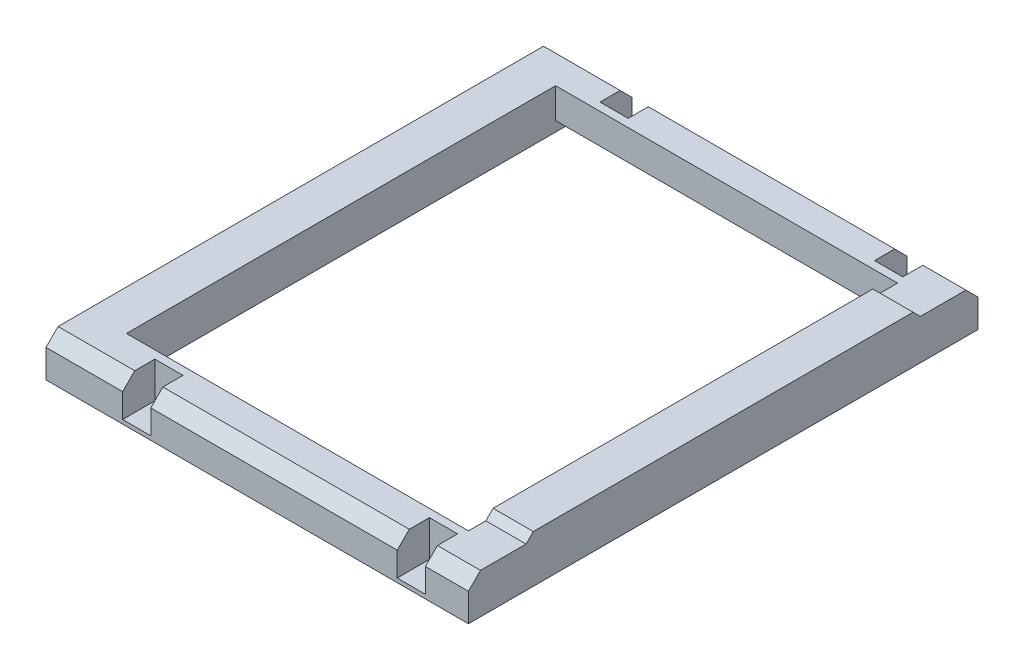
from build123d import *

# Parameters (mm, degrees)
SKETCH2_W           = 133.35
SKETCH2_H           = 160.866666666
SKETCH2_W_2         = 107.95
SKETCH2_H_2         = 135.466666666
BOSS_EXTRUDE1_DEPTH = 12.7
CUT_EXTRUDE1_DEPTH  = 6.35
CHAMFER1_SIZE       = 0.635
CHAMFER3_SIZE       = 3.81
SKETCH5_W           = 8.89
SKETCH5_H           = 11.43
CUT_EXTRUDE2_DEPTH  = 10.16
SKETCH6_W           = 8.89
SKETCH6_H           = 11.43
CUT_EXTRUDE3_DEPTH  = 10.16
CHAMFER4_SIZE       = 3.175
SKETCH7_W           = 12.7
SKETCH7_H           = 124.46
BOSS_EXTRUDE2_DEPTH = 2.286
CHAMFER5_SIZE       = 2.286


with BuildPart() as part:
    # Sketch2 → Boss-Extrude1 (new body)
    with BuildSketch(Plane(origin=(0, 0, 0), x_dir=(1, 0, 0), z_dir=(0, 1, 0))):
        Rectangle(SKETCH2_W, SKETCH2_H)
        Rectangle(SKETCH2_W_2, SKETCH2_H_2, mode=Mode.SUBTRACT)
    extrude(amount=BOSS_EXTRUDE1_DEPTH)

    # Sketch4 → Cut-Extrude1 (cut)
    with BuildSketch(Plane(origin=(0, 0, 0), x_dir=(1, 0, 0), z_dir=(0, 1, 0))):
        Polygon((-63.5, 76.2), (-60.325, 79.375), (-57.15, 76.2), (-60.325, 73.025), align=None)
        Polygon((-52.916666667, 76.2), (-49.741666667, 79.375), (-46.566666667, 76.2), (-49.741666667, 73.025), align=None)
        Polygon((57.15, 76.2), (60.325, 79.375), (63.5, 76.2), (60.325, 73.025), align=None)
        Polygon((57.15, -76.2), (60.325, -73.025), (63.5, -76.2), (60.325, -79.375), align=None)
        Polygon((-52.916666667, -76.2), (-49.741666667, -73.025), (-46.566666667, -76.2), (-49.741666667, -79.375), align=None)
        Polygon((-63.5, -76.2), (-60.325, -73.025), (-57.15, -76.2), (-60.325, -79.375), align=None)
    extrude(amount=CUT_EXTRUDE1_DEPTH, mode=Mode.SUBTRACT)

    # Chamfer1
    chamfer1_edges = [part.edges().sort_by_distance(p)[0] for p in [
        (-61.9125, 0, 77.7875),
        (-58.7375, 0, 77.7875),
        (-58.7375, 0, 74.6125),
        (-61.9125, 0, 74.6125),
        (-61.9125, 6.35, 77.7875),
        (-58.7375, 6.35, 77.7875),
        (-58.7375, 6.35, 74.6125),
        (-61.9125, 6.35, 74.6125),
        (-51.329166667, 0, 77.7875),
        (-52.916666667, 3.175, 76.2),
        (-48.154166667, 0, 77.7875),
        (-48.154166667, 0, 74.6125),
        (-51.329166667, 0, 74.6125),
        (-49.741666667, 3.175, 73.025),
        (-51.329166667, 6.35, 77.7875),
        (-48.154166667, 6.35, 77.7875),
        (-48.154166667, 6.35, 74.6125),
        (-51.329166667, 6.35, 74.6125),
        (58.7375, 0, 77.7875),
        (61.9125, 0, 77.7875),
        (61.9125, 0, 74.6125),
        (58.7375, 0, 74.6125),
        (58.7375, 6.35, 77.7875),
        (61.9125, 6.35, 77.7875),
        (61.9125, 6.35, 74.6125),
        (58.7375, 6.35, 74.6125),
        (58.7375, 0, -74.6125),
        (61.9125, 0, -74.6125),
        (61.9125, 0, -77.7875),
        (58.7375, 0, -77.7875),
        (58.7375, 6.35, -74.6125),
        (61.9125, 6.35, -74.6125),
        (61.9125, 6.35, -77.7875),
        (58.7375, 6.35, -77.7875),
        (-51.329166667, 0, -74.6125),
        (-48.154166667, 0, -74.6125),
        (-48.154166667, 0, -77.7875),
        (-51.329166667, 0, -77.7875),
        (-51.329166667, 6.35, -74.6125),
        (-48.154166667, 6.35, -74.6125),
        (-48.154166667, 6.35, -77.7875),
        (-51.329166667, 6.35, -77.7875),
        (-61.9125, 0, -74.6125),
        (-58.7375, 0, -74.6125),
        (-58.7375, 0, -77.7875),
        (-61.9125, 0, -77.7875),
        (-61.9125, 6.35, -74.6125),
        (-58.7375, 6.35, -74.6125),
        (-58.7375, 6.35, -77.7875),
        (-61.9125, 6.35, -77.7875),
    ]]
    chamfer(chamfer1_edges, length=CHAMFER1_SIZE)

    # Chamfer3
    chamfer3_edges = [part.edges().sort_by_distance(p)[0] for p in [
        (0, 12.7, -80.433333333),
        (0, 12.7, 80.433333333),
    ]]
    chamfer(chamfer3_edges, length=CHAMFER3_SIZE)

    # Sketch5 → Cut-Extrude2 (cut)
    with BuildSketch(Plane.XY.offset(80.433333333)):
        with Locations((-38.0365, 6.985)):
            Rectangle(SKETCH5_W, SKETCH5_H)
        with Locations((48.641, 6.985)):
            Rectangle(SKETCH5_W, SKETCH5_H)
    extrude(amount=-CUT_EXTRUDE2_DEPTH, mode=Mode.SUBTRACT)

    # Sketch6 → Cut-Extrude3 (cut)
    with BuildSketch(Plane(origin=(0, 0, -80.433333333), x_dir=(-1, 0, 0), z_dir=(0, 0, -1))):
        with Locations((38.0365, 6.985)):
            Rectangle(SKETCH6_W, SKETCH6_H)
        with Locations((-48.641, 6.985)):
            Rectangle(SKETCH6_W, SKETCH6_H)
    extrude(amount=-CUT_EXTRUDE3_DEPTH, mode=Mode.SUBTRACT)

    # Chamfer4
    chamfer4_edges = [part.edges().sort_by_distance(p)[0] for p in [
        (53.975, 0, 0),
        (0, 0, -67.733333333),
        (0, 0, 67.733333333),
    ]]
    chamfer(chamfer4_edges, length=CHAMFER4_SIZE)

    # Sketch7 → Boss-Extrude2 (add)
    with BuildSketch(Plane(origin=(0, 12.7, 0), x_dir=(1, 0, 0), z_dir=(0, 1, 0))):
        with Locations((60.325, 0)):
            Rectangle(SKETCH7_W, SKETCH7_H)
    extrude(amount=BOSS_EXTRUDE2_DEPTH)

    # Chamfer5
    chamfer5_edges = [part.edges().sort_by_distance(p)[0] for p in [
        (60.325, 14.986, 62.23),
        (60.325, 14.986, -62.23),
    ]]
    chamfer(chamfer5_edges, length=CHAMFER5_SIZE - 0.0001)  # a hair under: the kernel refuses the full size


solid = part.part
